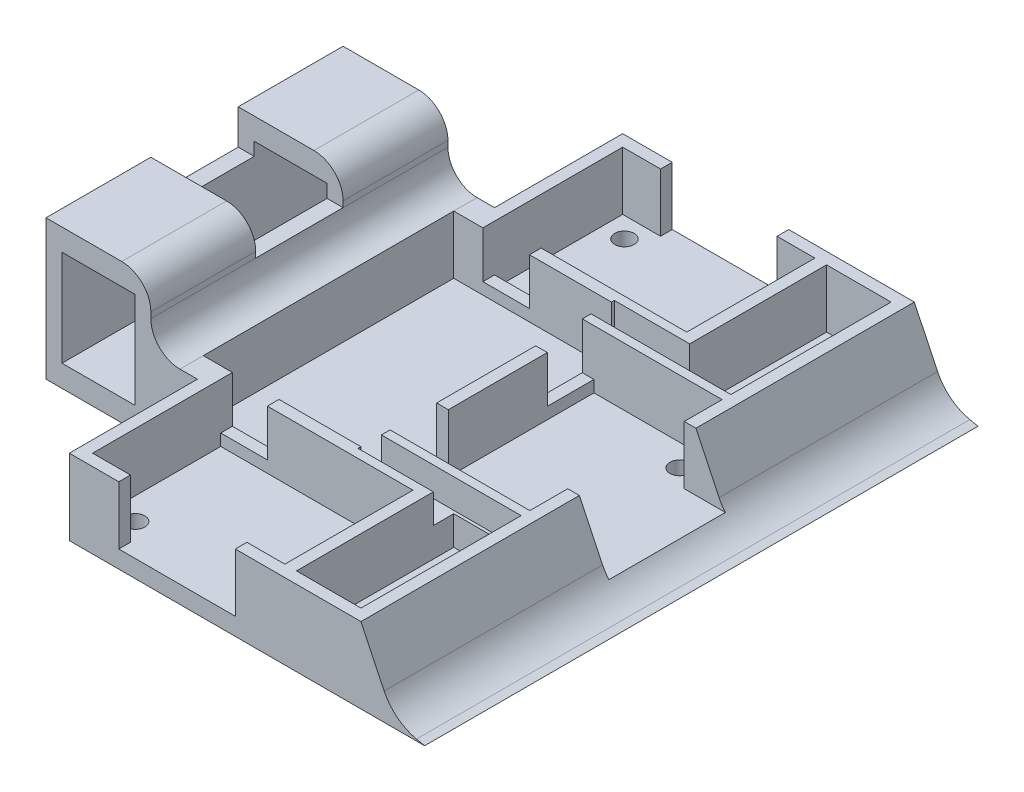
from build123d import *

# Parameters (mm, degrees)
SKETCH1_W           = 95
SKETCH1_H           = 95
BOSS_EXTRUDE2_DEPTH = 13
SKETCH2_W           = 22
SKETCH2_H           = 13
CUT_EXTRUDE1_DEPTH  = 34
SKETCH3_W           = 22
SKETCH3_H           = 13
CUT_EXTRUDE2_DEPTH  = 34
SKETCH5_W           = 26
SKETCH5_H           = 51
BOSS_EXTRUDE3_DEPTH = 20
SKETCH6_W           = 12
SKETCH6_H           = 16
CUT_EXTRUDE4_DEPTH  = 200
SKETCH7_W           = 26
SKETCH7_H           = 9
CUT_EXTRUDE5_DEPTH  = 200
FILLET2_R           = 5
SKETCH8_W           = 8
SKETCH8_H           = 24
CUT_EXTRUDE6_DEPTH  = 200
SKETCH9_W           = 33
SKETCH9_H           = 22
CUT_EXTRUDE7_DEPTH  = 10
SKETCH10_W          = 20
SKETCH10_H          = 10
CUT_EXTRUDE10_DEPTH = 10
SKETCH13_W          = 33
SKETCH13_H          = 22
CUT_EXTRUDE11_DEPTH = 10
SKETCH14_W          = 20
SKETCH14_H          = 10
CUT_EXTRUDE12_DEPTH = 10
SKETCH18_W          = 20
SKETCH18_H          = 10
CUT_EXTRUDE16_DEPTH = 50
CUT_EXTRUDE17_DEPTH = 100000
SKETCH20_W          = 22
SKETCH20_H          = 33
CUT_EXTRUDE18_DEPTH = 10
SKETCH21_W          = 27.070242808
SKETCH21_H          = 43
CUT_EXTRUDE19_DEPTH = 10
SKETCH22_W          = 2
SKETCH22_H          = 20
BOSS_EXTRUDE4_DEPTH = 10
SKETCH23_W          = 12.5
SKETCH23_H          = 16.5
CUT_EXTRUDE20_DEPTH = 200
SKETCH24_W          = 8
SKETCH24_H          = 2
CUT_EXTRUDE21_DEPTH = 8
SKETCH25_W          = 8
SKETCH25_H          = 2
CUT_EXTRUDE22_DEPTH = 8
SKETCH26_W          = 2
SKETCH26_H          = 8
CUT_EXTRUDE24_DEPTH = 8
SKETCH27_W          = 2
SKETCH27_H          = 8
CUT_EXTRUDE25_DEPTH = 8
SKETCH28_W          = 11.070242808
SKETCH28_H          = 27
CUT_EXTRUDE26_DEPTH = 10
SKETCH29_W          = 11.070242808
SKETCH29_H          = 27
CUT_EXTRUDE27_DEPTH = 10
SKETCH30_W          = 24
SKETCH30_H          = 4
CUT_EXTRUDE29_DEPTH = 5
SKETCH31_W          = 24
SKETCH31_H          = 4
CUT_EXTRUDE30_DEPTH = 5
SKETCH32_W          = 5
SKETCH32_H          = 5
CUT_EXTRUDE32_DEPTH = 5
SKETCH40_W          = 5
SKETCH40_H          = 10
CUT_EXTRUDE39_DEPTH = 5
SKETCH41_R          = 1.2
CUT_EXTRUDE40_DEPTH = 5
SKETCH42_W          = 5
SKETCH42_H          = 5
CUT_EXTRUDE41_DEPTH = 5
SKETCH43_R          = 1.2
CUT_EXTRUDE42_DEPTH = 5
SKETCH44_R          = 1.666
CUT_EXTRUDE43_DEPTH = 5
SKETCH45_R          = 1.666
CUT_EXTRUDE44_DEPTH = 5
SKETCH46_R          = 1.666
CUT_EXTRUDE45_DEPTH = 5
FILLET6_R           = 8
SKETCH47_W          = 15
SKETCH47_H          = 6
CUT_EXTRUDE46_DEPTH = 100


with BuildPart() as part:
    # Sketch1 → Boss-Extrude2 (new body)
    with BuildSketch(Plane(origin=(0, 0, 0), x_dir=(1, 0, 0), z_dir=(0, 1, 0))):
        Rectangle(SKETCH1_W, SKETCH1_H)
    extrude(amount=BOSS_EXTRUDE2_DEPTH)

    # Sketch2 → Cut-Extrude1 (cut)
    with BuildSketch(Plane.ZY.offset(47.5)):
        with Locations((36.5, 6.5)):
            Rectangle(SKETCH2_W, SKETCH2_H)
    extrude(amount=-CUT_EXTRUDE1_DEPTH, mode=Mode.SUBTRACT)

    # Sketch3 → Cut-Extrude2 (cut)
    with BuildSketch(Plane.ZY.offset(47.5)):
        with Locations((-36.5, 6.5)):
            Rectangle(SKETCH3_W, SKETCH3_H)
    extrude(amount=-CUT_EXTRUDE2_DEPTH, mode=Mode.SUBTRACT)

    # Sketch5 → Boss-Extrude3 (add)
    with BuildSketch(Plane(origin=(0, 13, 0), x_dir=(1, 0, 0), z_dir=(0, 1, 0))):
        with Locations((-34.5, 0)):
            Rectangle(SKETCH5_W, SKETCH5_H)
    extrude(amount=BOSS_EXTRUDE3_DEPTH)

    # Sketch6 → Cut-Extrude4 (cut)
    with BuildSketch(Plane.XY.offset(25.5)):
        with Locations((-30.5, 12)):
            Rectangle(SKETCH6_W, SKETCH6_H)
    extrude(amount=-CUT_EXTRUDE4_DEPTH, mode=Mode.SUBTRACT)

    # Sketch7 → Cut-Extrude5 (cut)
    with BuildSketch(Plane.XY.offset(25.5)):
        with Locations((-34.5, 28.5)):
            Rectangle(SKETCH7_W, SKETCH7_H)
    extrude(amount=-CUT_EXTRUDE5_DEPTH, mode=Mode.SUBTRACT)

    # Fillet2
    fillet2_edges = [part.edges().sort_by_distance(p)[0] for p in [
        (-21.5, 24, 0),
        (-21.5, 13, 0),
    ]]
    fillet(fillet2_edges, radius=FILLET2_R)

    # Sketch8 → Cut-Extrude6 (cut)
    with BuildSketch(Plane.XY.offset(25.5)):
        with Locations((-43.5, 12)):
            Rectangle(SKETCH8_W, SKETCH8_H)
    extrude(amount=-CUT_EXTRUDE6_DEPTH, mode=Mode.SUBTRACT)

    # Sketch9 → Cut-Extrude7 (cut)
    with BuildSketch(Plane(origin=(0, 13, 0), x_dir=(1, 0, 0), z_dir=(0, 1, 0))):
        with Locations((5, -34.5)):
            Rectangle(SKETCH9_W, SKETCH9_H)
    extrude(amount=-CUT_EXTRUDE7_DEPTH, mode=Mode.SUBTRACT)

    # Sketch10 → Cut-Extrude10 (cut)
    with BuildSketch(Plane.XY.offset(47.5)):
        with Locations((5, 8)):
            Rectangle(SKETCH10_W, SKETCH10_H)
    extrude(amount=-CUT_EXTRUDE10_DEPTH, mode=Mode.SUBTRACT)

    # Sketch13 → Cut-Extrude11 (cut)
    with BuildSketch(Plane(origin=(0, 13, 0), x_dir=(1, 0, 0), z_dir=(0, 1, 0))):
        with Locations((5, 34.5)):
            Rectangle(SKETCH13_W, SKETCH13_H)
    extrude(amount=-CUT_EXTRUDE11_DEPTH, mode=Mode.SUBTRACT)

    # Sketch14 → Cut-Extrude12 (cut)
    with BuildSketch(Plane(origin=(0, 0, -47.5), x_dir=(-1, 0, 0), z_dir=(0, 0, -1))):
        with Locations((-5, 8)):
            Rectangle(SKETCH14_W, SKETCH14_H)
    extrude(amount=-CUT_EXTRUDE12_DEPTH, mode=Mode.SUBTRACT)

    # Sketch18 → Cut-Extrude16 (cut)
    with BuildSketch(Plane(origin=(47.5, 0, 0), x_dir=(0, 0, -1), z_dir=(1, 0, 0))):
        with Locations((0, 8)):
            Rectangle(SKETCH18_W, SKETCH18_H)
    extrude(amount=-CUT_EXTRUDE16_DEPTH, mode=Mode.SUBTRACT)

    # Sketch19 → Cut-Extrude17 (cut)
    with BuildSketch(Plane.XY.offset(47.5)):
        Polygon((47.5, 0), (42.252710702, 1.120152934), (36.570242808, 13), (47.5, 13), align=None)
    extrude(amount=-CUT_EXTRUDE17_DEPTH, mode=Mode.SUBTRACT)

    # Sketch20 → Cut-Extrude18 (cut)
    with BuildSketch(Plane(origin=(0, 13, 0), x_dir=(1, 0, 0), z_dir=(0, 1, 0))):
        with Locations((23.570242808, 0)):
            Rectangle(SKETCH20_W, SKETCH20_H)
    extrude(amount=-CUT_EXTRUDE18_DEPTH, mode=Mode.SUBTRACT)

    # Sketch21 → Cut-Extrude19 (cut)
    with BuildSketch(Plane(origin=(0, 13, 0), x_dir=(1, 0, 0), z_dir=(0, 1, 0))):
        with Locations((-2.964878596, 0)):
            Rectangle(SKETCH21_W, SKETCH21_H)
    extrude(amount=-CUT_EXTRUDE19_DEPTH, mode=Mode.SUBTRACT)

    # Sketch22 → Boss-Extrude4 (add)
    with BuildSketch(Plane(origin=(0, 3, 0), x_dir=(1, 0, 0), z_dir=(0, 1, 0))):
        with Locations((11.570242808, 0)):
            Rectangle(SKETCH22_W, SKETCH22_H)
    extrude(amount=BOSS_EXTRUDE4_DEPTH)

    # Sketch23 → Cut-Extrude20 (cut)
    with BuildSketch(Plane.XY.offset(25.5)):
        with Locations((-30.5, 12)):
            Rectangle(SKETCH23_W, SKETCH23_H)
    extrude(amount=-CUT_EXTRUDE20_DEPTH, mode=Mode.SUBTRACT)

    # Sketch24 → Cut-Extrude21 (cut)
    with BuildSketch(Plane(origin=(0, 13, 0), x_dir=(1, 0, 0), z_dir=(0, 1, 0))):
        with Locations((-7.5, -22.5)):
            Rectangle(SKETCH24_W, SKETCH24_H)
    extrude(amount=-CUT_EXTRUDE21_DEPTH, mode=Mode.SUBTRACT)

    # Sketch25 → Cut-Extrude22 (cut)
    with BuildSketch(Plane(origin=(0, 13, 0), x_dir=(1, 0, 0), z_dir=(0, 1, 0))):
        with Locations((-7.5, 22.5)):
            Rectangle(SKETCH25_W, SKETCH25_H)
    extrude(amount=-CUT_EXTRUDE22_DEPTH, mode=Mode.SUBTRACT)

    # Sketch26 → Cut-Extrude24 (cut)
    with BuildSketch(Plane(origin=(0, 13, 0), x_dir=(1, 0, 0), z_dir=(0, 1, 0))):
        with Locations((11.570242808, -12.5)):
            Rectangle(SKETCH26_W, SKETCH26_H)
    extrude(amount=-CUT_EXTRUDE24_DEPTH, mode=Mode.SUBTRACT)

    # Sketch27 → Cut-Extrude25 (cut)
    with BuildSketch(Plane(origin=(0, 13, 0), x_dir=(1, 0, 0), z_dir=(0, 1, 0))):
        with Locations((11.570242808, 12.5)):
            Rectangle(SKETCH27_W, SKETCH27_H)
    extrude(amount=-CUT_EXTRUDE25_DEPTH, mode=Mode.SUBTRACT)

    # Sketch28 → Cut-Extrude26 (cut)
    with BuildSketch(Plane(origin=(0, 13, 0), x_dir=(1, 0, 0), z_dir=(0, 1, 0))):
        with Locations((29.035121404, -32)):
            Rectangle(SKETCH28_W, SKETCH28_H)
    extrude(amount=-CUT_EXTRUDE26_DEPTH, mode=Mode.SUBTRACT)

    # Sketch29 → Cut-Extrude27 (cut)
    with BuildSketch(Plane(origin=(0, 13, 0), x_dir=(1, 0, 0), z_dir=(0, 1, 0))):
        with Locations((29.035121404, 32)):
            Rectangle(SKETCH29_W, SKETCH29_H)
    extrude(amount=-CUT_EXTRUDE27_DEPTH, mode=Mode.SUBTRACT)

    # Sketch30 → Cut-Extrude29 (cut)
    with BuildSketch(Plane(origin=(0, 13, 0), x_dir=(1, 0, 0), z_dir=(0, 1, 0))):
        with Locations((22.570242808, -20)):
            Rectangle(SKETCH30_W, SKETCH30_H)
    extrude(amount=-CUT_EXTRUDE29_DEPTH, mode=Mode.SUBTRACT)

    # Sketch31 → Cut-Extrude30 (cut)
    with BuildSketch(Plane(origin=(0, 13, 0), x_dir=(1, 0, 0), z_dir=(0, 1, 0))):
        with Locations((22.570242808, 20)):
            Rectangle(SKETCH31_W, SKETCH31_H)
    extrude(amount=-CUT_EXTRUDE30_DEPTH, mode=Mode.SUBTRACT)

    # Sketch32 → Cut-Extrude32 (cut)
    with BuildSketch(Plane(origin=(0, 3, 0), x_dir=(1, 0, 0), z_dir=(0, 1, 0))):
        with Locations((29.035242808, -39)):
            Rectangle(SKETCH32_W, SKETCH32_H)
    extrude(amount=-CUT_EXTRUDE32_DEPTH, mode=Mode.SUBTRACT)

    # Sketch40 → Cut-Extrude39 (cut)
    with BuildSketch(Plane(origin=(0, 3, 0), x_dir=(1, 0, 0), z_dir=(0, 1, 0))):
        with Locations((29.035, 36.5)):
            Rectangle(SKETCH40_W, SKETCH40_H)
    extrude(amount=-CUT_EXTRUDE39_DEPTH, mode=Mode.SUBTRACT)

    # Sketch41 → Cut-Extrude40 (cut)
    with BuildSketch(Plane(origin=(0, 3, 0), x_dir=(1, 0, 0), z_dir=(0, 1, 0))):
        with Locations(Location((29.035, 28.5, 0), (0, 0, 270))):
            Circle(SKETCH41_R)
    extrude(amount=-CUT_EXTRUDE40_DEPTH, mode=Mode.SUBTRACT)

    # Sketch42 → Cut-Extrude41 (cut)
    with BuildSketch(Plane(origin=(0, 3, 0), x_dir=(1, 0, 0), z_dir=(0, 1, 0))):
        with Locations((29.035242808, -34)):
            Rectangle(SKETCH42_W, SKETCH42_H)
    extrude(amount=-CUT_EXTRUDE41_DEPTH, mode=Mode.SUBTRACT)

    # Sketch43 → Cut-Extrude42 (cut)
    with BuildSketch(Plane(origin=(0, 3, 0), x_dir=(1, 0, 0), z_dir=(0, 1, 0))):
        with Locations(Location((29.035242808, -28.5, 0), (0, 0, 270))):
            Circle(SKETCH43_R)
    extrude(amount=-CUT_EXTRUDE42_DEPTH, mode=Mode.SUBTRACT)

    # Sketch44 → Cut-Extrude43 (cut)
    with BuildSketch(Plane(origin=(0, 3, 0), x_dir=(1, 0, 0), z_dir=(0, 1, 0))):
        with Locations(Location((-7.7, 42, 0), (0, 0, 270))):
            Circle(SKETCH44_R)
        with Locations(Location((17.7, 42, 0), (0, 0, 270))):
            Circle(SKETCH44_R)
    extrude(amount=-CUT_EXTRUDE43_DEPTH, mode=Mode.SUBTRACT)

    # Sketch45 → Cut-Extrude44 (cut)
    with BuildSketch(Plane(origin=(0, 3, 0), x_dir=(1, 0, 0), z_dir=(0, 1, 0))):
        with Locations(Location((-7.7, -42, 0), (0, 0, 270))):
            Circle(SKETCH45_R)
        with Locations(Location((17.7, -42, 0), (0, 0, 270))):
            Circle(SKETCH45_R)
    extrude(amount=-CUT_EXTRUDE44_DEPTH, mode=Mode.SUBTRACT)

    # Sketch46 → Cut-Extrude45 (cut)
    with BuildSketch(Plane(origin=(0, 3, 0), x_dir=(1, 0, 0), z_dir=(0, 1, 0))):
        with Locations(Location((31.070242808, -12.7, 0), (0, 0, 270))):
            Circle(SKETCH46_R)
        with Locations(Location((31.070242808, 12.7, 0), (0, 0, 270))):
            Circle(SKETCH46_R)
    extrude(amount=-CUT_EXTRUDE45_DEPTH, mode=Mode.SUBTRACT)

    # Fillet6
    # the kernel refuses this fillet: 8 mm, written as the material it adds along each edge
    with BuildSketch(Plane(origin=(42.252710702, 1.120152934, 47.5), x_dir=(-0.4315050547709999, 0.902110518565811, 0), z_dir=(0, 0, -1))) as fillet6_piece_1_section:
        with BuildLine():
            CenterArc((FILLET6_R * 0.491916580905, FILLET6_R), FILLET6_R, 217.613324298, 52.386675702)
            Line((-FILLET6_R * 0.300231150017, FILLET6_R * 0.389670603367), (0, 0))
            Line((0, 0), (FILLET6_R * 0.491916580905, 0))
        make_face()
    fillet6_piece_1 = extrude(amount=95, mode=Mode.PRIVATE)
    fillet6_piece_1 = split(fillet6_piece_1, bisect_by=Plane(origin=(40.996343353, 3.680803438, 10), z_dir=(0, 0, 1)), keep=Keep.TOP, mode=Mode.PRIVATE)
    fillet6_piece_1 = split(fillet6_piece_1, bisect_by=Plane(origin=(40.996343353, 3, 28.75), z_dir=(0, 1, 0)), keep=Keep.TOP, mode=Mode.PRIVATE)
    add(fillet6_piece_1)
    with BuildSketch(Plane(origin=(42.252710702, 1.120152934, 47.5), x_dir=(-0.4315050547709999, 0.902110518565811, 0), z_dir=(0, 0, -1))) as fillet6_piece_2_section:
        with BuildLine():
            CenterArc((FILLET6_R * 0.491916580905, FILLET6_R), FILLET6_R, 217.613324298, 52.386675702)
            Line((-FILLET6_R * 0.300231150017, FILLET6_R * 0.389670603367), (0, 0))
            Line((0, 0), (FILLET6_R * 0.491916580905, 0))
        make_face()
    fillet6_piece_2 = extrude(amount=95, mode=Mode.PRIVATE)
    fillet6_piece_2 = split(fillet6_piece_2, bisect_by=Plane(origin=(42.958701315, 1.423679354, 10), z_dir=(0, 0, 1)), keep=Keep.TOP, mode=Mode.PRIVATE)
    fillet6_piece_2 = split(fillet6_piece_2, bisect_by=Plane(origin=(42.958701315, 3, 28.75), z_dir=(0, -1, 0)), keep=Keep.TOP, mode=Mode.PRIVATE)
    add(fillet6_piece_2)
    with BuildSketch(Plane(origin=(42.252710702, 1.120152934, 47.5), x_dir=(-0.4315050547709999, 0.902110518565811, 0), z_dir=(0, 0, -1))) as fillet6_piece_3_section:
        with BuildLine():
            CenterArc((FILLET6_R * 0.491916580905, FILLET6_R), FILLET6_R, 217.613324298, 52.386675702)
            Line((-FILLET6_R * 0.300231150017, FILLET6_R * 0.389670603367), (0, 0))
            Line((0, 0), (FILLET6_R * 0.491916580905, 0))
        make_face()
    fillet6_piece_3 = extrude(amount=95, mode=Mode.PRIVATE)
    fillet6_piece_3 = split(fillet6_piece_3, bisect_by=Plane(origin=(42.958701315, 1.423679354, 10), z_dir=(0, 0, -1)), keep=Keep.TOP, mode=Mode.PRIVATE)
    fillet6_piece_3 = split(fillet6_piece_3, bisect_by=Plane(origin=(42.958701315, 3, 0), z_dir=(0, -1, 0)), keep=Keep.TOP, mode=Mode.PRIVATE)
    fillet6_piece_3 = split(fillet6_piece_3, bisect_by=Plane(origin=(42.958701315, 1.423679354, -10), z_dir=(0, 0, 1)), keep=Keep.TOP, mode=Mode.PRIVATE)
    add(fillet6_piece_3)
    with BuildSketch(Plane(origin=(42.252710702, 1.120152934, 47.5), x_dir=(-0.4315050547709999, 0.902110518565811, 0), z_dir=(0, 0, -1))) as fillet6_piece_4_section:
        with BuildLine():
            CenterArc((FILLET6_R * 0.491916580905, FILLET6_R), FILLET6_R, 217.613324298, 52.386675702)
            Line((-FILLET6_R * 0.300231150017, FILLET6_R * 0.389670603367), (0, 0))
            Line((0, 0), (FILLET6_R * 0.491916580905, 0))
        make_face()
    fillet6_piece_4 = extrude(amount=95, mode=Mode.PRIVATE)
    fillet6_piece_4 = split(fillet6_piece_4, bisect_by=Plane(origin=(40.996343353, 3, -28.75), z_dir=(0, 1, 0)), keep=Keep.TOP, mode=Mode.PRIVATE)
    fillet6_piece_4 = split(fillet6_piece_4, bisect_by=Plane(origin=(40.996343353, 3.680803438, -10), z_dir=(0, 0, -1)), keep=Keep.TOP, mode=Mode.PRIVATE)
    add(fillet6_piece_4)
    with BuildSketch(Plane(origin=(42.252710702, 1.120152934, 47.5), x_dir=(-0.4315050547709999, 0.902110518565811, 0), z_dir=(0, 0, -1))) as fillet6_piece_5_section:
        with BuildLine():
            CenterArc((FILLET6_R * 0.491916580905, FILLET6_R), FILLET6_R, 217.613324298, 52.386675702)
            Line((-FILLET6_R * 0.300231150017, FILLET6_R * 0.389670603367), (0, 0))
            Line((0, 0), (FILLET6_R * 0.491916580905, 0))
        make_face()
    fillet6_piece_5 = extrude(amount=95, mode=Mode.PRIVATE)
    fillet6_piece_5 = split(fillet6_piece_5, bisect_by=Plane(origin=(42.958701315, 3, -28.75), z_dir=(0, -1, 0)), keep=Keep.TOP, mode=Mode.PRIVATE)
    fillet6_piece_5 = split(fillet6_piece_5, bisect_by=Plane(origin=(42.958701315, 1.423679354, -10), z_dir=(0, 0, -1)), keep=Keep.TOP, mode=Mode.PRIVATE)
    add(fillet6_piece_5)

    # Sketch47 → Cut-Extrude46 (cut)
    with BuildSketch(Plane.ZY.offset(39.5)):
        with Locations((0, 21)):
            Rectangle(SKETCH47_W, SKETCH47_H)
    extrude(amount=-CUT_EXTRUDE46_DEPTH, mode=Mode.SUBTRACT)


solid = part.part
